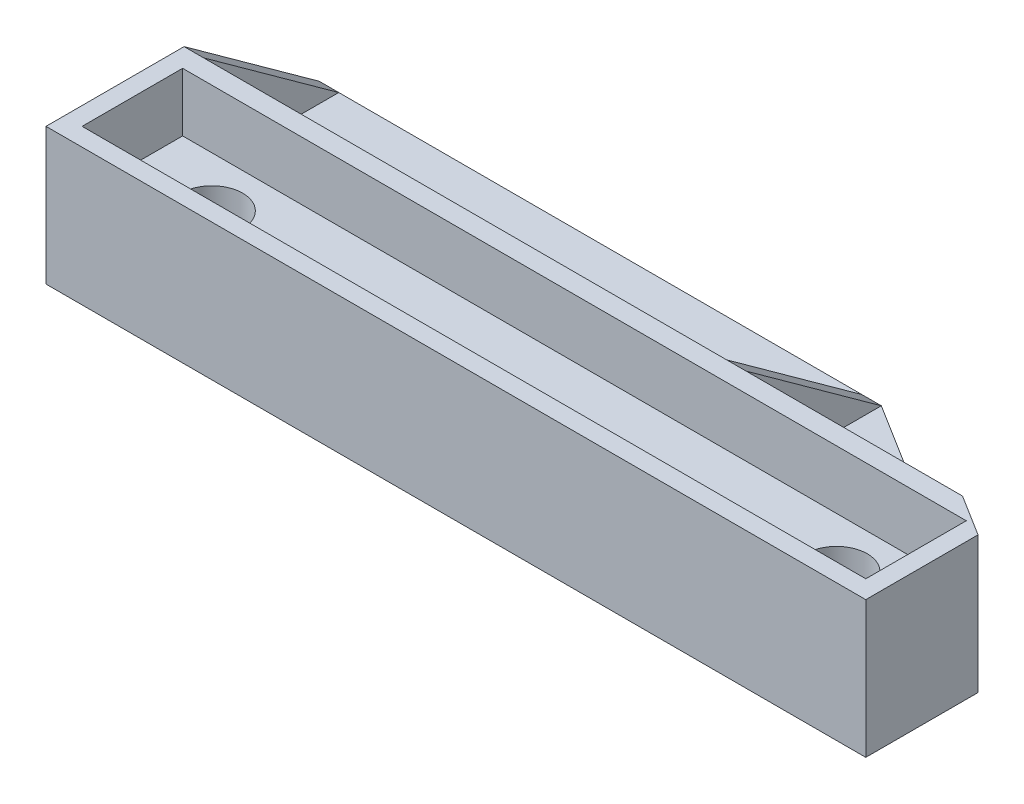
from build123d import *

# Parameters (mm, degrees)
RISER_DEPTH             = 7
SKETCH2_R               = 1.575
MOUNTING_HOLES_DEPTH    = 44.150898021
SKETCH3_W               = 40.15
SKETCH3_H               = 5.15
RECESS_DEPTH            = 3
FLANGE_DEPTH            = 7
SKETCH5_W               = 26.797240136
SKETCH5_H               = 6.925
FLANGE_CUTOUT_DEPTH     = 5
ANGLE_CUTOUT_DEPTH      = 32.901199964
ANGLE_CUTOUT_DEPTH_BACK = 32.901199964
FLANGE_CHAMFER_1_SIZE   = 1
FLANGE_CHAMFER_2_SIZE   = 1


with BuildPart() as part:
    # Sketch1 → Riser (new body)
    with BuildSketch(Plane(origin=(0, 0, 0), x_dir=(1, 0, 0), z_dir=(0, 1, 0))):
        Polygon((39.999581839, 7), (42, 5.75), (42, 0), (0, 0), (0, 7), align=None)
    extrude(amount=RISER_DEPTH)

    # Sketch2 → Mounting Holes (cut, through all)
    with BuildSketch(Plane.XZ):
        with Locations((5, -3.5)):
            Circle(SKETCH2_R)
        with Locations((37, -3.5)):
            Circle(SKETCH2_R)
    extrude(amount=-MOUNTING_HOLES_DEPTH, mode=Mode.SUBTRACT)

    # Sketch3 → Recess (cut)
    with BuildSketch(Plane(origin=(0, 7, 0), x_dir=(1, 0, 0), z_dir=(0, 1, 0))):
        with Locations((21, 3.5)):
            Rectangle(SKETCH3_W, SKETCH3_H)
    extrude(amount=-RECESS_DEPTH, mode=Mode.SUBTRACT)

    # Sketch4 → Flange (add)
    with BuildSketch(Plane(origin=(0, 0, 0), x_dir=(1, 0, 0), z_dir=(0, 1, 0))):
        Polygon((0, 7), (39.999581839, 7), (28.797240136, 14), (0, 14), align=None)
    extrude(amount=FLANGE_DEPTH)

    # Sketch5 → Flange Cutout (cut)
    with BuildSketch(Plane(origin=(0, 7, 0), x_dir=(1, 0, 0), z_dir=(0, 1, 0))):
        with Locations((14.398620068, 10.5375)):
            Rectangle(SKETCH5_W, SKETCH5_H)
        Polygon((28.797240136, 14), (28.797240136, 7.075), (39.879556749, 7.075), align=None)
    extrude(amount=-FLANGE_CUTOUT_DEPTH, mode=Mode.SUBTRACT)

    # Sketch7 → Angle Cutout (cut, two sides: drawn at the far end of the back side and taken through both)
    with BuildSketch(Plane.ZY.offset(-27.797240136).offset(-ANGLE_CUTOUT_DEPTH_BACK)):
        Polygon((-7.075, 7), (-14, 2), (-14, 7), align=None)
    extrude(amount=ANGLE_CUTOUT_DEPTH + ANGLE_CUTOUT_DEPTH_BACK, mode=Mode.SUBTRACT)

    # Flange Chamfer 1
    flange_chamfer_1_edges = [part.edges().sort_by_distance(p)[0] for p in [
        (14.398620068, 2, -7.075),
    ]]
    chamfer(flange_chamfer_1_edges, length=FLANGE_CHAMFER_1_SIZE)

    # Flange Chamfer 2
    flange_chamfer_2_edges = [part.edges().sort_by_distance(p)[0] for p in [
        (34.338398442, 2, -7.075),
    ]]
    chamfer(flange_chamfer_2_edges, length=FLANGE_CHAMFER_2_SIZE)


solid = part.part
